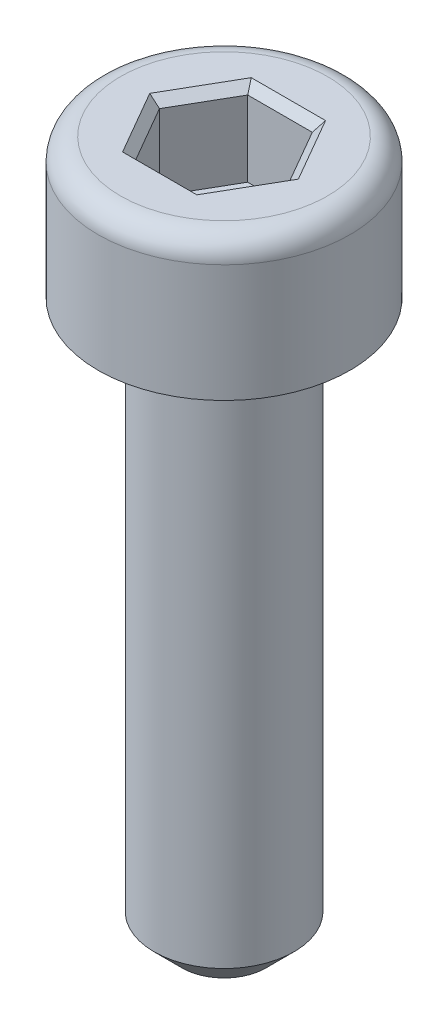
from build123d import *

# Parameters (mm, degrees)
ENL_V_MAT_EXTRU_1_DEPTH = 1.5
CHANFREIN1_SIZE         = 0.15


with BuildPart() as part:
    # Esquisse1 → Révolution1 (revolve)
    with BuildSketch(Plane.XY):
        with BuildLine():
            Line((1.25, -9.5), (0.75, -10))
            Line((0.75, -10), (0, -10))
            Line((0, -10), (0, 2.5))
            Line((0, 2.5), (1.85, 2.5))
            ThreePointArc((1.85, 2.5), (2.132842712, 2.382842712), (2.25, 2.1))
            Line((2.25, 2.1), (2.25, 0))
            Line((2.25, 0), (1.25, 0))
            Line((1.25, 0), (1.25, -9.5))
        make_face()
    revolve(axis=Axis((0, 6.972972973, 0), (0, -1, 0)))

    # Esquisse2 → Enlèv. mat.-Extru.1 (cut)
    with BuildSketch(Plane(origin=(0, 2.5, 0), x_dir=(1, 0, 0), z_dir=(0, 1, 0))):
        Polygon((-1.154700538, 0), (-0.577350269, -1), (0.577350269, -1), (1.154700538, 0), (0.577350269, 1), (-0.577350269, 1), align=None)
    extrude(amount=-ENL_V_MAT_EXTRU_1_DEPTH, mode=Mode.SUBTRACT)

    # Chanfrein1
    chanfrein1_edges = [part.edges().sort_by_distance(p)[0] for p in [
        (-0.866025404, 2.5, -0.5),
        (-0.866025404, 2.5, 0.5),
        (0, 2.5, 1),
        (0.866025404, 2.5, 0.5),
        (0.866025404, 2.5, -0.5),
        (0, 2.5, -1),
    ]]
    chamfer(chanfrein1_edges, length=CHANFREIN1_SIZE)


solid = part.part
